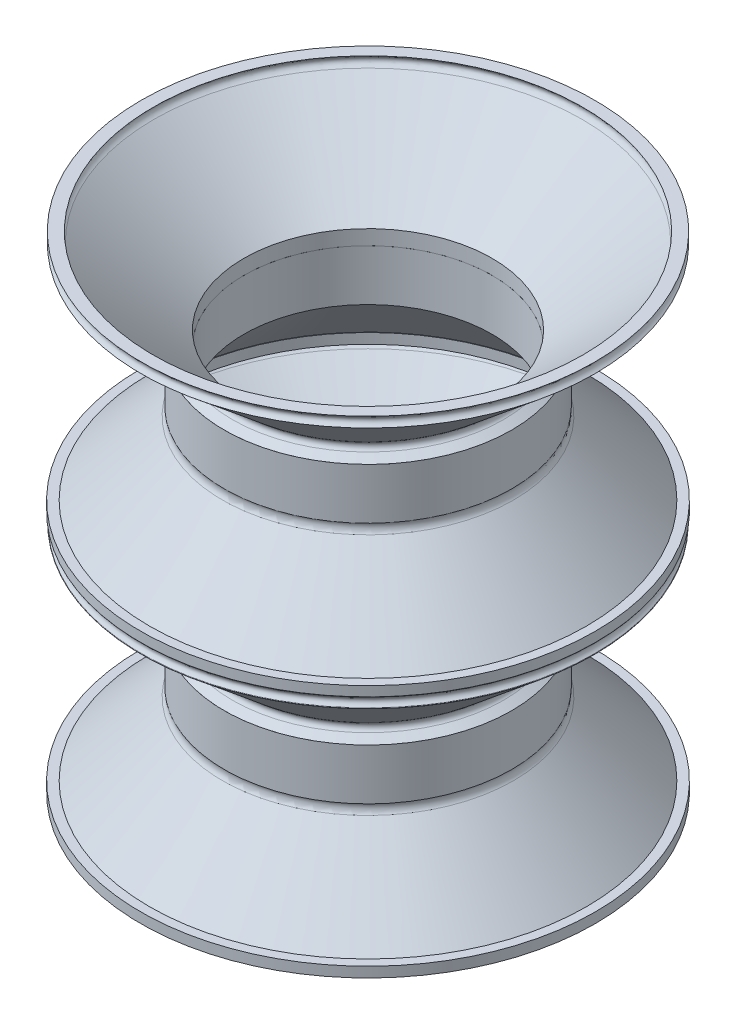
from build123d import *

# Parameters (mm, degrees)
ACTIVE_FILLET_R     = 0.5
SKETCH11_R          = 14.103676922
SKETCH11_R_2        = 12.180725781
COLLAR_DEPTH        = 5
PASSIVE_FILLET_R    = 0.8
SKETCH18_R          = 22.294579061
SKETCH18_R_2        = 20.130725781
BOSS_EXTRUDE4_DEPTH = 1
FILLET3_R           = 0.05
FILLET7_R           = 0.05


# Read off the part's stored shape, not the designer's step: Body-Move/Copy2
with BuildPart() as part:
    # Sketch1 → Main Active (revolve)
    with BuildSketch(Plane.XY):
        Polygon((-0.44430417, 0), (-9.978332911, 8), (-8.73375385, 8), (0.085520369, 0.599750256), (0.085520369, -0.848184734), (-1.837430772, -0.848184734), align=None)
    revolve(axis=Axis((12.26624615, 7.609018033, 0), (0, -1, 0)))

    # Active fillet
    active_fillet_edges = [part.edges().sort_by_distance(p)[0] for p in [
        (24.976796471, 0, 0),
    ]]
    fillet(active_fillet_edges, radius=ACTIVE_FILLET_R)

    # Sketch17 → Neck Curve (revolve)
    with BuildSketch(Plane.XY, mode=Mode.PRIVATE) as neck_curve_sk:
        with BuildLine():
            Line((-9.978332911, 8), (-8.73375385, 8))
            add(Edge.make_bspline(
                [(-8.73375385, 8), (-9.417134244, 8.454758025), (-8.796578829, 9)],
                knots=[0, 0, 0, 1, 1, 1], degree=2))
            Line((-8.796578829, 9), (-9.978332911, 9))
            add(Edge.make_bspline(
                [(-9.978332911, 8), (-9.322292514, 8.483356917), (-9.978332911, 9)],
                knots=[0, 0, 0, 1, 1, 1], degree=2))
        make_face()
    revolve(neck_curve_sk.sketch.rotate(Axis((12.26624615, -19.96984433, 0), (0, 1, 0)), 180), axis=Axis((12.26624615, -19.96984433, 0), (0, 1, 0)))

    # Fillet3
    fillet3_edges = [part.edges().sort_by_distance(p)[0] for p in [
        (12.26624615, 8, -22.244579061),
    ]]
    fillet(fillet3_edges, radius=FILLET3_R)


with BuildPart() as body_2:
    # Sketch11 → collar (new body)
    with BuildSketch(Plane.XZ.offset(0.848184734)):
        with Locations((12.26624615, 0)):
            Circle(SKETCH11_R)
        with Locations((12.26624615, 0)):
            Circle(SKETCH11_R_2, mode=Mode.SUBTRACT)
    extrude(amount=COLLAR_DEPTH)

    # Sketch14 → Passive Element (revolve)
    with BuildSketch(Plane.XY, mode=Mode.PRIVATE) as passive_element_sk:
        Polygon((-1.158987566, -5.848184734), (-9.158987566, -13.848184734), (-7.914479631, -13.848184734), (0.085520369, -5.848184734), align=None)
    revolve(passive_element_sk.sketch.rotate(Axis((12.26624615, -19.96984433, 0), (0, 1, 0)), 180), axis=Axis((12.26624615, -19.96984433, 0), (0, 1, 0)))

    # Passive Fillet
    # the kernel refuses this fillet: 0.8 mm, written as the material it adds along each edge
    with BuildSketch(Plane(origin=(12.26624615, -5.848184734, 0), x_dir=(1, 0, 0), z_dir=(0, 0, 1))) as passive_fillet_piece_1:
        with BuildLine():
            CenterArc((14.848517188, -0.291912621), PASSIVE_FILLET_R, 158.599138918, 66.400861082)
            Line((14.282831763, -0.857598046), (14.271518054, -0.868911755))
            Line((14.271518054, -0.868911755), (13.413920008, -0.011313708))
            Line((13.413920008, -0.011313708), (13.425233716, 0.016))
            ThreePointArc((13.425233716, 0.016), (13.764455319, 0.016), (14.088780117, 0.005838252))
            Line((14.088780117, 0.005838252), (14.103676922, 0))
        make_face()
    revolve(axis=Axis((12.26624615, -5.848184734, 0), (0, 1, 0)))

    # Sketch18 → Boss-Extrude4 (add)
    with BuildSketch(Plane.XZ.offset(13.848184734)):
        with Locations((12.26624615, 0)):
            Circle(SKETCH18_R)
        with Locations((12.26624615, 0)):
            Circle(SKETCH18_R_2, mode=Mode.SUBTRACT)
    extrude(amount=BOSS_EXTRUDE4_DEPTH)


with BuildPart() as body_3:
    # Body-Move/Copy2 outline → Body-Move/Copy2 (revolve)
    with BuildSketch(Plane(origin=(12.26624615, 0, 0), x_dir=(1, 0, 0), z_dir=(0, 0, 1))):
        with BuildLine():
            Line((14.103676922, 22.991815266), (13.305602068, 23.477711456))
            ThreePointArc((13.305602068, 23.477711456), (13.067048008, 23.867010025), (13.24422527, 24.287806453))
            Line((13.24422527, 24.287806453), (22.244579061, 31.84))
            add(Edge.make_bspline(
                [(22.244579061, 32.84), (21.588538664, 32.323356917), (22.244579061, 31.84)],
                knots=[0, 0, 0, 1, 1, 1], degree=2))
            Line((22.244579061, 32.84), (21.062824979, 32.84))
            add(Edge.make_bspline(
                [(21.062824979, 32.84), (21.683380394, 32.294758025), (21, 31.84)],
                knots=[0.048181037, 0.048181037, 0.048181037, 1.048181037, 1.048181037, 1.048181037], degree=2))
            Line((21, 31.84), (12.180725781, 24.439750256))
            Line((12.180725781, 24.439750256), (12.180725781, 22.991815266))
            Line((12.180725781, 22.991815266), (14.103676922, 22.991815266))
        make_face()
    revolve(axis=Axis((12.26624615, 0, 0), (0, 1, 0)))


with BuildPart() as body_4:
    # Body-Move_Copy2 2 outline → Body-Move_Copy2 2 (revolve)
    with BuildSketch(Plane(origin=(12.26624615, 0, 0), x_dir=(1, 0, 0), z_dir=(0, 0, 1))):
        with BuildLine():
            Line((14.103676922, 22.991815266), (12.180725781, 22.991815266))
            Line((12.180725781, 22.991815266), (12.180725781, 17.991815266))
            Line((12.180725781, 17.991815266), (20.180725781, 9.991815266))
            Line((20.180725781, 9.991815266), (20.130725781, 9.991815266))
            Line((20.130725781, 9.991815266), (20.130725781, 8.991815266))
            Line((20.130725781, 8.991815266), (22.294579061, 8.991815266))
            Line((22.294579061, 8.991815266), (22.294579061, 9.991815266))
            Line((22.294579061, 9.991815266), (21.425233716, 9.991815266))
            Line((21.425233716, 9.991815266), (14.282831763, 17.134217219))
            ThreePointArc((14.282831763, 17.134217219), (14.065422047, 17.536311687), (14.103676922, 17.991815266))
            Line((14.103676922, 17.991815266), (14.103676922, 22.991815266))
        make_face()
    revolve(axis=Axis((12.26624615, 0, 0), (0, 1, 0)))

    # Fillet7
    fillet7_edges = [body_4.edges().sort_by_distance(p)[0] for p in [
        (-10.028332911, 8.991815266, 0),
    ]]
    fillet(fillet7_edges, radius=FILLET7_R)


solid = Compound([part.part, body_2.part, body_3.part, body_4.part])
